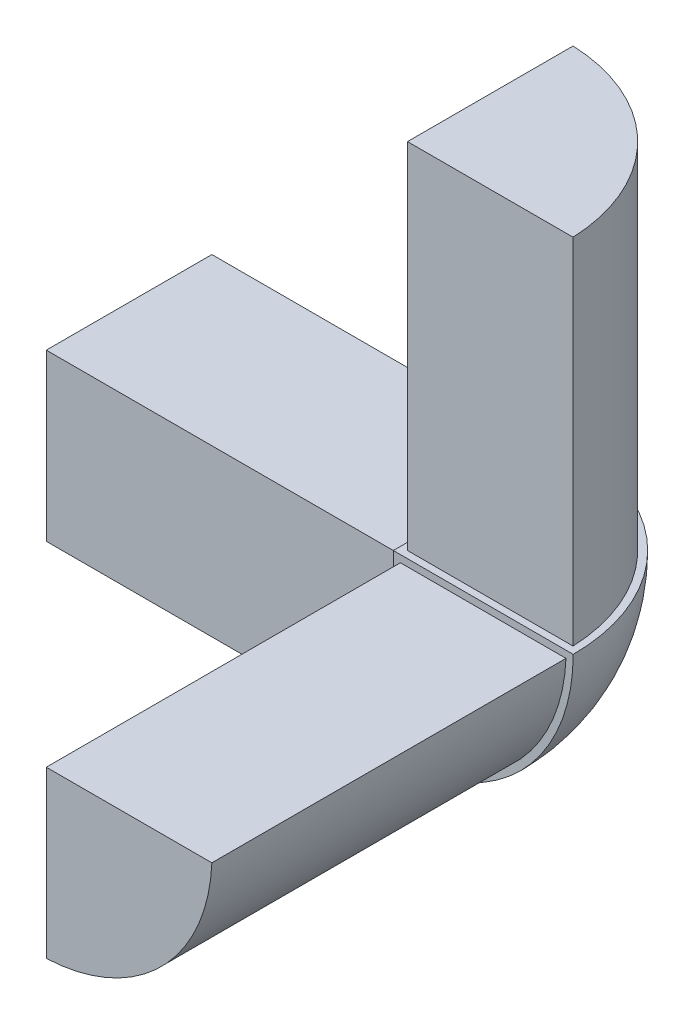
from build123d import *

# Parameters (mm, degrees)
SALIENTE_EXTRUIR1_DEPTH = 50
SALIENTE_EXTRUIR2_DEPTH = 50
SALIENTE_EXTRUIR3_DEPTH = 50
CORTAR_EXTRUIR1_DEPTH   = 30
CROQUIS8_W              = 25.4
CROQUIS8_H              = 25.4
CORTAR_EXTRUIR5_DEPTH   = 50
CROQUIS9_W              = 25.4
CROQUIS9_H              = 25.4
CORTAR_EXTRUIR6_DEPTH   = 50
CORTAR_EXTRUIR7_START   = -50
CORTAR_EXTRUIR7_DEPTH   = 50
CORTAR_EXTRUIR8_START   = -50
CORTAR_EXTRUIR8_DEPTH   = 50
CORTAR_EXTRUIR9_START   = -50
CORTAR_EXTRUIR9_DEPTH   = 50


with BuildPart() as part:
    # Croquis1 → Revolución1 (revolve)
    with BuildSketch(Plane.XY):
        with BuildLine():
            Line((0, 25.4), (0, -25.4))
            ThreePointArc((0, -25.4), (25.4, 0), (0, 25.4))
        make_face()
    revolve(axis=Axis((0, 32.899125747, 0), (0, -1, 0)))

    # Croquis2 → Saliente-Extruir1 (add)
    with BuildSketch(Plane(origin=(0, 0, 0), x_dir=(1, 0, 0), z_dir=(0, 1, 0))):
        with BuildLine():
            Line((0, 25.4), (0, 0))
            Line((0, 0), (25.4, 0))
            ThreePointArc((25.4, 0), (17.960512242, 17.960512242), (0, 25.4))
        make_face()
    extrude(amount=SALIENTE_EXTRUIR1_DEPTH)

    # Croquis3 → Saliente-Extruir2 (add)
    with BuildSketch(Plane.XY):
        with BuildLine():
            Line((0, 0), (25.4, 0))
            ThreePointArc((25.4, 0), (17.960512242, -17.960512242), (0, -25.4))
            Line((0, -25.4), (0, 0))
        make_face()
    extrude(amount=SALIENTE_EXTRUIR2_DEPTH)

    # Croquis4 → Saliente-Extruir3 (add)
    with BuildSketch(Plane(origin=(0, 0, 0), x_dir=(0, 0, -1), z_dir=(1, 0, 0))):
        with BuildLine():
            Line((25.4, 0), (0, 0))
            Line((0, 0), (0, -25.4))
            ThreePointArc((0, -25.4), (17.960512242, -17.960512242), (25.4, 0))
        make_face()
    extrude(amount=-SALIENTE_EXTRUIR3_DEPTH)

    # Croquis5 → Cortar-Extruir1 (cut, symmetric)
    with BuildSketch(Plane.XY):
        with BuildLine():
            Line((0, 25.4), (0, 0))
            Line((0, 0), (-25.4, 0))
            ThreePointArc((-25.4, 0), (-17.960512242, 17.960512242), (0, 25.4))
        make_face()
    extrude(amount=CORTAR_EXTRUIR1_DEPTH, both=True, mode=Mode.SUBTRACT)

    # Croquis8 → Cortar-Extruir5 (cut)
    with BuildSketch(Plane(origin=(0, 0, 0), x_dir=(0, 0, -1), z_dir=(1, 0, 0))):
        with Locations((-12.7, 12.7)):
            Rectangle(CROQUIS8_W, CROQUIS8_H)
    extrude(amount=CORTAR_EXTRUIR5_DEPTH, mode=Mode.SUBTRACT)

    # Croquis9 → Cortar-Extruir6 (cut)
    with BuildSketch(Plane(origin=(0, 0, 0), x_dir=(1, 0, 0), z_dir=(0, 1, 0))):
        with Locations((-12.7, -12.7)):
            Rectangle(CROQUIS9_W, CROQUIS9_H)
    extrude(amount=-CORTAR_EXTRUIR6_DEPTH, mode=Mode.SUBTRACT)

    # Croquis11 → Cortar-Extruir7 (cut)
    with BuildSketch(Plane.ZY.offset(50).offset(CORTAR_EXTRUIR7_START)):
        with BuildLine():
            Line((0, -25.4), (0, 0))
            Line((0, 0), (-25.4, 0))
            ThreePointArc((-25.4, 0), (-17.960512242, -17.960512242), (0, -25.4))
        make_face()
        with BuildLine():
            Line((-1, -24.379499585), (-1, -1))
            Line((-1, -1), (-24.379499585, -1))
            ThreePointArc((-24.379499585, -1), (-17.253405461, -17.253405461), (-1, -24.379499585))
        make_face(mode=Mode.SUBTRACT)
    extrude(amount=CORTAR_EXTRUIR7_DEPTH, mode=Mode.SUBTRACT)

    # Croquis12 → Cortar-Extruir8 (cut)
    with BuildSketch(Plane(origin=(0, 50, 0), x_dir=(1, 0, 0), z_dir=(0, 1, 0)).offset(CORTAR_EXTRUIR8_START)):
        with BuildLine():
            Line((0, 25.4), (0, 0))
            Line((0, 0), (25.4, 0))
            ThreePointArc((25.4, 0), (17.960512242, 17.960512242), (0, 25.4))
        make_face()
        with BuildLine():
            Line((1, 24.379499585), (1, 1))
            Line((1, 1), (24.379499585, 1))
            ThreePointArc((24.379499585, 1), (17.253405461, 17.253405461), (1, 24.379499585))
        make_face(mode=Mode.SUBTRACT)
    extrude(amount=CORTAR_EXTRUIR8_DEPTH, mode=Mode.SUBTRACT)

    # Croquis13 → Cortar-Extruir9 (cut)
    with BuildSketch(Plane.XY.offset(50).offset(CORTAR_EXTRUIR9_START)):
        with BuildLine():
            Line((0, 0), (0, -25.4))
            ThreePointArc((0, -25.4), (17.960512242, -17.960512242), (25.4, 0))
            Line((25.4, 0), (0, 0))
        make_face()
        with BuildLine():
            Line((1, -1), (1, -24.379499585))
            ThreePointArc((1, -24.379499585), (17.253405461, -17.253405461), (24.379499585, -1))
            Line((24.379499585, -1), (1, -1))
        make_face(mode=Mode.SUBTRACT)
    extrude(amount=CORTAR_EXTRUIR9_DEPTH, mode=Mode.SUBTRACT)


solid = part.part
